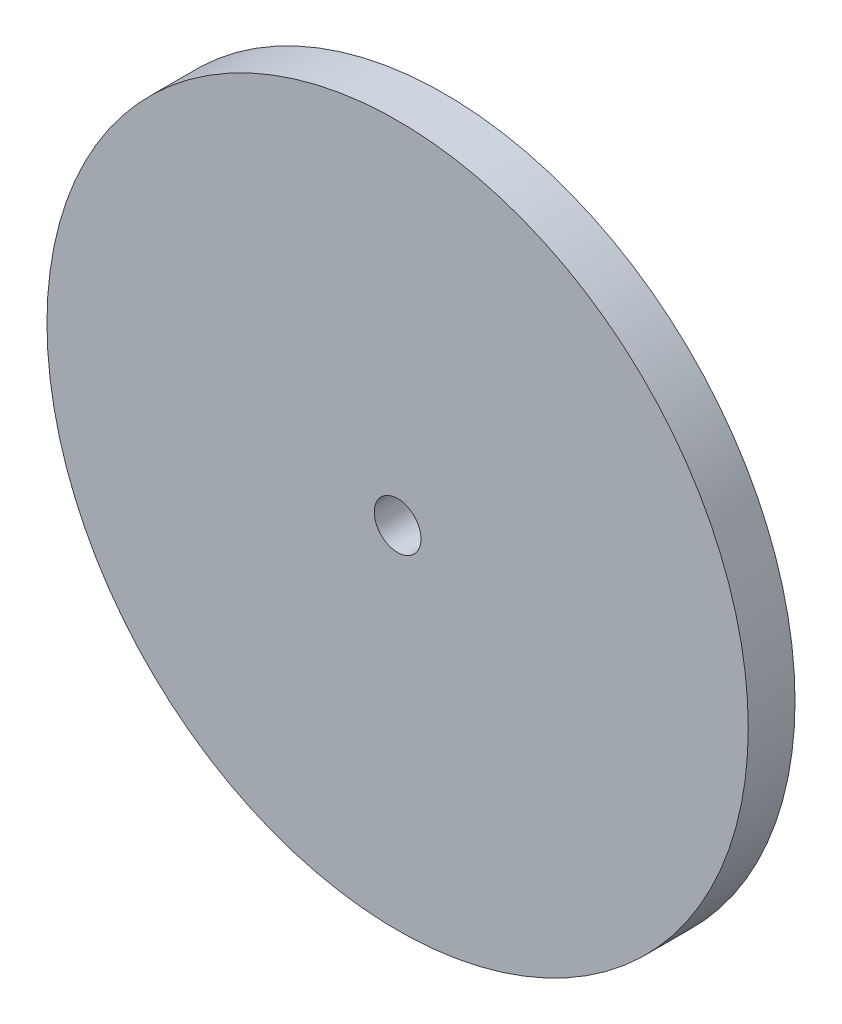
from build123d import *

# Parameters (mm, degrees)
SKETCH1_R           = 15
BOSS_EXTRUDE1_DEPTH = 2
SKETCH2_R           = 1
CUT_EXTRUDE1_DEPTH  = 2


with BuildPart() as part:
    # Sketch1 → Boss-Extrude1 (new body)
    with BuildSketch(Plane.XY):
        Circle(SKETCH1_R)
    extrude(amount=BOSS_EXTRUDE1_DEPTH)

    # Sketch2 → Cut-Extrude1 (cut)
    with BuildSketch(Plane.XY.offset(2)):
        Circle(SKETCH2_R)
    extrude(amount=-CUT_EXTRUDE1_DEPTH, mode=Mode.SUBTRACT)


solid = part.part
